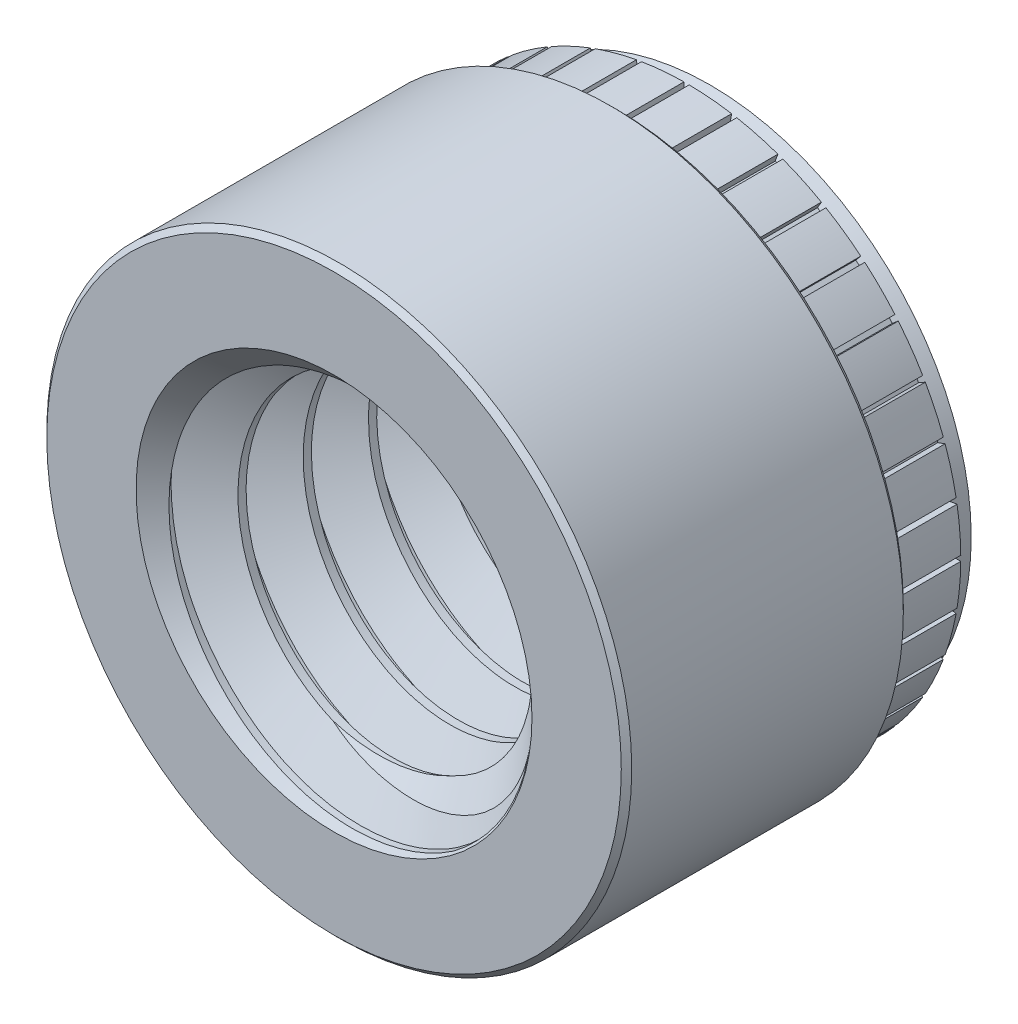
from build123d import *

# Parameters (mm, degrees)
SKETCH1_R               = 7.112
EXTRUDE1_DEPTH          = 6.858
SKETCH2_R               = 6.6675
EXTRUDE2_DEPTH          = 2.286
SKETCH3_W               = 0.127
SKETCH3_H               = 0.635
CUT_EXTRUDE_THIN1_DEPTH = 2.286
CIRPATTERN1_COUNT       = 36
SKETCH5_OUTSIDE_W       = 21.06
SKETCH5_OUTSIDE_H       = 21.06
SKETCH5_OUTSIDE_R       = 6.35
CUT_EXTRUDE1_DEPTH      = 0.5715
CUT_EXTRUDE1_DRAFT      = 20
CHAMFER2_SIZE           = 0.127
SKETCH7_R               = 4.7625
CUT_EXTRUDE3_DEPTH      = 14.593153571
SWEEP1_PITCH            = 1.5875
SKETCH10_R              = 7.112
CUT_EXTRUDE4_DEPTH      = 15.564001666
SKETCH11_R              = 6.35
CUT_EXTRUDE5_DEPTH      = 14.593153638


with BuildPart() as part:
    # Sketch1 → Extrude1 (new body)
    with BuildSketch(Plane.XY):
        Circle(SKETCH1_R)
    extrude(amount=-EXTRUDE1_DEPTH)

    # Sketch2 → Extrude2 (add)
    with BuildSketch(Plane(origin=(0, 0, -6.858), x_dir=(-1, 0, 0), z_dir=(0, 0, -1))):
        with Locations(Location((0, 0, 0), (0, 0, 180))):
            Circle(SKETCH2_R)
    extrude(amount=EXTRUDE2_DEPTH)

    # Sketch3 → Cut-Extrude-Thin1 (cut)
    with BuildSketch(Plane(origin=(0, 0, -9.144), x_dir=(-1, 0, 0), z_dir=(0, 0, -1))):
        with Locations((0, 6.7945)):
            Rectangle(SKETCH3_W, SKETCH3_H)
    cut_extrude_thin1 = extrude(amount=-CUT_EXTRUDE_THIN1_DEPTH, mode=Mode.SUBTRACT)

    # CirPattern1: Cut-Extrude-Thin1 ×36 about axis
    cirpattern1_axis = Axis((0, 0, 0), (0, 0, 1))
    for i in range(1, CIRPATTERN1_COUNT):
        add(cut_extrude_thin1.rotate(cirpattern1_axis, i * 360 / CIRPATTERN1_COUNT), mode=Mode.SUBTRACT)


with BuildPart() as cut_extrude1_tool:
    # Sketch5 outside → Cut-Extrude1 (with draft: the straight prism first)
    with BuildSketch(Plane(origin=(0, 0, -9.144), x_dir=(-1, 0, 0), z_dir=(0, 0, -1))):
        Rectangle(SKETCH5_OUTSIDE_W, SKETCH5_OUTSIDE_H)
        Circle(SKETCH5_OUTSIDE_R, mode=Mode.SUBTRACT)
    extrude(amount=-CUT_EXTRUDE1_DEPTH)
    # Cut-Extrude1: the draft: its side faces are tilted about the plane it starts from
    cut_extrude1_sides = [cut_extrude1_tool.faces().sort_by_distance(p)[0] for p in [
        (0, -10.53, -8.85825),
        (-10.53, 0, -8.85825),
        (0, 10.53, -8.85825),
        (10.53, 0, -8.85825),
        (6.35, 0, -8.85825),
    ]]
    draft(cut_extrude1_sides, Plane(origin=(0, 0, -9.144), x_dir=(-1, 0, 0), z_dir=(0, 0, -1)), CUT_EXTRUDE1_DRAFT)


with BuildPart() as part_1:
    add(part.part)

    # Cut-Extrude1: cut by cut_extrude1_tool
    add(cut_extrude1_tool.part, mode=Mode.SUBTRACT)

    # Chamfer2
    chamfer2_edges = [part_1.edges().sort_by_distance(p)[0] for p in [
        (-7.112, 0, 0),
        (-7.112, 0, -6.858),
    ]]
    chamfer(chamfer2_edges, length=CHAMFER2_SIZE)

    # Sketch7 → Cut-Extrude3 (cut, through all)
    with BuildSketch(Plane.XY):
        Circle(SKETCH7_R)
    extrude(amount=-CUT_EXTRUDE3_DEPTH, mode=Mode.SUBTRACT)

    # Sweep1: arcs per turn and ends read off the stored shape
    # Sweep1: the profile of Sketch9 profile screwed along a right-hand helix through 8 turns, 6 arcs to a turn; built about Z, then put on its axis
    sweep1_z = Axis((0, 0, 0), (0, 0, 1))
    sweep1_corners = [(4.7628, 0, -1.389235705), (3.731388504, 0, -0.79375), (3.731388504, 0, -0.5953125), (4.7628, 0, 0.000173205)]
    with BuildLine(mode=Mode.PRIVATE) as sweep1_profile:
        Line(sweep1_corners[0], sweep1_corners[1])
        Line(sweep1_corners[1], sweep1_corners[2])
        Line(sweep1_corners[2], sweep1_corners[3])
        Line(sweep1_corners[3], sweep1_corners[0])
    sweep1_cap = Face(sweep1_profile.wire())
    sweep1_turn_angles = [0, 30, 60, 90, 120, 150, 180, 210, 240, 270, 300, 330, 360]
    sweep1_turn_weights = [1, 0.8660254037844387, 1, 0.8660254037844387, 1, 0.8660254037844387, 1, 0.8660254037844387, 1, 0.8660254037844387, 1, 0.8660254037844387, 1]
    sweep1_turn_rails = [Edge.make_bspline([Vector(p[0], p[1], 0).rotate(sweep1_z, sweep1_turn_angles[k]) / sweep1_turn_weights[k] + Vector(0, 0, p[2] + SWEEP1_PITCH * sweep1_turn_angles[k] / 360) for k in range(13)], [0, 0, 0, 1, 1, 2, 2, 3, 3, 4, 4, 5, 5, 6, 6, 6], 2, sweep1_turn_weights) for p in sweep1_corners]
    sweep1_turn_sides = [Face.make_surface_from_curves(sweep1_turn_rails[p[0]], sweep1_turn_rails[p[1]]) for p in [(0, 1), (1, 2), (2, 3), (3, 0)]]
    sweep1_turn = Solid(Shell([*sweep1_turn_sides, sweep1_cap, sweep1_cap.rotate(sweep1_z, 360).moved(Location((0, 0, SWEEP1_PITCH * 360 / 360)))]))
    sweep1_each = [*[sweep1_turn.moved(Location((0, 0, SWEEP1_PITCH * i))) for i in range(8)]]
    add(Plane(origin=(0, 0, -9.144), x_dir=(0, 1, 0), z_dir=(0, 0, 1)) * Compound([sweep1_each[i] for i in range(0, 8, 2)]))
    add(Plane(origin=(0, 0, -9.144), x_dir=(0, 1, 0), z_dir=(0, 0, 1)) * Compound([sweep1_each[i] for i in range(1, 8, 2)]))

    # Sketch10 → Cut-Extrude4 (cut, through all)
    with BuildSketch(Plane.XY):
        Circle(SKETCH10_R)
    extrude(amount=CUT_EXTRUDE4_DEPTH, mode=Mode.SUBTRACT)

    # Sketch11 → Cut-Extrude5 (cut, through all)
    with BuildSketch(Plane(origin=(0, 0, -9.144), x_dir=(-1, 0, 0), z_dir=(0, 0, -1))):
        Circle(SKETCH11_R)
    extrude(amount=CUT_EXTRUDE5_DEPTH, mode=Mode.SUBTRACT)

    # Cut-Extrude6 cone 1 section (through the dimple's axis) → Cut-Extrude6 (revolve, cut)
    with BuildSketch(Plane(origin=(0, 0, 0), x_dir=(0, -1, 0), z_dir=(1, 0, 0))):
        Polygon((0, 0), (4.8133, 0), (0, 4.8133), align=None)
    revolve(axis=Axis((0, 0, 0), (0, 0, -1)), mode=Mode.SUBTRACT)

    # Cut-Extrude7 cone 1 section (through the dimple's axis) → Cut-Extrude7 (revolve, cut)
    with BuildSketch(Plane(origin=(0, 0, -9.144), x_dir=(0, 1, 0), z_dir=(1, 0, 0))):
        Polygon((0, 0), (4.8133, 0), (0, 4.8133), align=None)
    revolve(axis=Axis((0, 0, -9.144), (0, 0, 1)), mode=Mode.SUBTRACT)


solid = part_1.part
